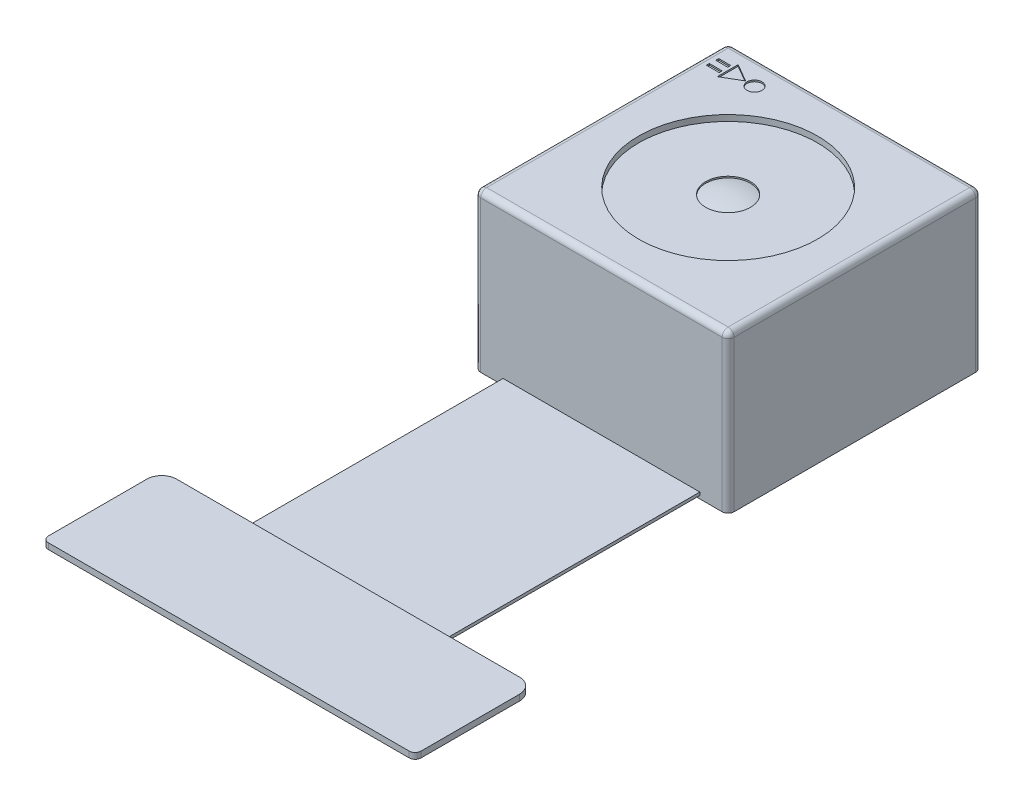
from build123d import *

# Parameters (mm, degrees)
SM_BASE_FLANGE_1_DEPTH = 0.1
SKETCH_6_W             = 12.5
SKETCH_6_H             = 4
EXTRUDE_1_DEPTH        = 0.1
SKETCH_7_W             = 8.5
SKETCH_7_H             = 8.5
EXTRUDE_2_DEPTH        = 0.1
SKETCH_8_W             = 8.5
SKETCH_8_H             = 8.5
EXTRUDE_3_DEPTH        = 5.07
SKETCH_9_R             = 3
CUT_EXTRUDE_1_DEPTH    = 0.2
FILLET_2_R             = 0.5
FILLET_3_R             = 0.2
SKETCH_11_R            = 0.25
SKETCH_11_W            = 0.4
SKETCH_11_H            = 0.1
SKETCH_11_W_2          = 0.428641975
CUT_EXTRUDE_2_DEPTH    = 0.05
FILLET_4_R             = 0.2
FILLET_5_R             = 0.2
SKETCH_13_R            = 0.75
CUT_EXTRUDE_3_DEPTH    = 0.05
DOME_1_FACE_RADIUS     = 0.75
DOME_1_HEIGHT          = 0.1
CUT_EXTRUDE_4_DEPTH    = 0.05


# Sheet-metal steps are written as plain solids
with BuildPart() as part:
    # Sketch 1 → Базовая кромка1 (new body)
    with BuildSketch(Plane(origin=(0, 0, 0), x_dir=(1, 0, 0), z_dir=(0, 1, 0))):
        Polygon((-6.25, 4), (-6.25, 0), (6.25, 0), (6.25, 4), (3.3, 4), (3.3, 12.5), (4.25, 12.5), (4.25, 21), (-4.25, 21), (-4.25, 12.5), (-3.3, 12.5), (-3.3, 4), align=None)
    extrude(amount=-SM_BASE_FLANGE_1_DEPTH)

    # Эскиз6 → Бобышка-Вытянуть1 (add)
    with BuildSketch(Plane(origin=(0, 0, 0), x_dir=(1, 0, 0), z_dir=(0, 1, 0))):
        with Locations((0, 2)):
            Rectangle(SKETCH_6_W, SKETCH_6_H)
    extrude(amount=EXTRUDE_1_DEPTH)

    # Эскиз7 → Бобышка-Вытянуть2 (add)
    with BuildSketch(Plane.XZ.offset(0.1)):
        with Locations((0, -16.75)):
            Rectangle(SKETCH_7_W, SKETCH_7_H)
    extrude(amount=EXTRUDE_2_DEPTH)

    # Эскиз8 → Бобышка-Вытянуть3 (add)
    with BuildSketch(Plane(origin=(0, 0, 0), x_dir=(1, 0, 0), z_dir=(0, 1, 0))):
        with Locations((0, 16.75)):
            Rectangle(SKETCH_8_W, SKETCH_8_H)
    extrude(amount=EXTRUDE_3_DEPTH)

    # Эскиз9 → Вырез-Вытянуть1 (cut)
    with BuildSketch(Plane(origin=(0, 5.07, 0), x_dir=(1, 0, 0), z_dir=(0, 1, 0))):
        with Locations(Location((0, 16.75, 0), (0, 0, 270))):
            Circle(SKETCH_9_R)
    extrude(amount=-CUT_EXTRUDE_1_DEPTH, mode=Mode.SUBTRACT)

    # Скругление2
    fillet_2_edges = [part.edges().sort_by_distance(p)[0] for p in [
        (6.25, 0, -4),
        (-6.25, 0, -4),
    ]]
    fillet(fillet_2_edges, radius=FILLET_2_R)

    # Скругление3
    fillet_3_edges = [part.edges().sort_by_distance(p)[0] for p in [
        (6.25, 0, 0),
        (-6.25, 0, 0),
    ]]
    fillet(fillet_3_edges, radius=FILLET_3_R)

    # Эскиз11 → Вырез-Вытянуть2 (cut)
    with BuildSketch(Plane(origin=(0, 5.07, 0), x_dir=(1, 0, 0), z_dir=(0, 1, 0))):
        with Locations(Location((-2.504881476, 20.140788589, 0), (0, 0, 270))):
            Circle(SKETCH_11_R)
        Polygon((-3.404881476, 20.490788589), (-3.404881476, 19.790788589), (-2.804881476, 20.140788589), align=None)
        with Locations((-3.704881476, 20.290788589)):
            Rectangle(SKETCH_11_W, SKETCH_11_H)
        with Locations((-3.704881477, 19.990788589)):
            Rectangle(SKETCH_11_W_2, SKETCH_11_H)
    extrude(amount=-CUT_EXTRUDE_2_DEPTH, mode=Mode.SUBTRACT)

    # Скругление4
    fillet_4_edges = [part.edges().sort_by_distance(p)[0] for p in [
        (-4.25, 2.435, -12.5),
        (-4.25, 2.435, -21),
        (4.25, 2.435, -21),
        (4.25, 2.435, -12.5),
    ]]
    fillet(fillet_4_edges, radius=FILLET_4_R)

    # Скругление5
    fillet_5_edges = [part.edges().sort_by_distance(p)[0] for p in [
        (0, 5.07, -21),
        (-4.25, 5.07, -16.75),
        (0, 5.07, -12.5),
        (4.25, 5.07, -16.75),
        (4.191421356, 5.07, -12.558578644),
        (-4.191421356, 5.07, -12.558578644),
        (4.191421356, 5.07, -20.941421356),
        (-4.191421356, 5.07, -20.941421356),
    ]]
    fillet(fillet_5_edges, radius=FILLET_5_R)

    # Эскиз13 → Вырез-Вытянуть3 (cut)
    with BuildSketch(Plane(origin=(0, 4.87, 0), x_dir=(1, 0, 0), z_dir=(0, 1, 0))):
        with Locations(Location((0, 16.75, 0), (0, 0, 270))):
            Circle(SKETCH_13_R)
    extrude(amount=-CUT_EXTRUDE_3_DEPTH, mode=Mode.SUBTRACT)

    # Купол1: a dome of height H over a round flat face of radius A is a cap of a sphere of radius (A * A + H * H) / (2 * H)
    dome_1_r = (DOME_1_FACE_RADIUS * DOME_1_FACE_RADIUS + DOME_1_HEIGHT * DOME_1_HEIGHT) / (2 * DOME_1_HEIGHT)
    dome_1_base = Plane((0, 4.82, -16.75), z_dir=(0, 1, 0))
    with Locations(dome_1_base.offset(DOME_1_HEIGHT - dome_1_r)):
        dome_1_ball = Sphere(dome_1_r, mode=Mode.PRIVATE)
    add(split(dome_1_ball, bisect_by=dome_1_base, keep=Keep.TOP, mode=Mode.PRIVATE))

    # Эскиз14 → Вырез-Вытянуть4 (cut)
    with BuildSketch(Plane.XZ.offset(0.1)):
        with BuildLine():
            add(Edge.make_bspline(
                [(-6.003383397, -0.314306436), (-6.003208457, -0.309686598), (-6.002887878, -0.301220725), (-6.001492735, -0.289495252), (-5.998110788, -0.280222293), (-5.994627409, -0.272683421), (-5.990132541, -0.267041234), (-5.984854454, -0.263323548), (-5.979244173, -0.261024904), (-5.975355275, -0.260713676), (-5.973471862, -0.260562946)],
                knots=[0, 0, 0, 0, 1.628349121, 2.98395659, 4.129704748, 5.086564407, 5.897483759, 6.63370628, 7.338296972, 8, 8, 8, 8], degree=3))
            Line((-5.973471862, -0.260562946), (-5.410745912, -0.260562946))
            add(Edge.make_bspline(
                [(-5.410745912, -0.260562946), (-5.40885651, -0.260694679), (-5.405106012, -0.26095617), (-5.399775012, -0.263392441), (-5.394773829, -0.267176005), (-5.390117693, -0.272704247), (-5.385920232, -0.280035282), (-5.383175234, -0.289598664), (-5.381181748, -0.301173725), (-5.380956895, -0.309674519), (-5.380834377, -0.314306436)],
                knots=[0, 0, 0, 0, 0.664614152, 1.319270975, 2.035609743, 2.868536476, 3.856564754, 4.99840066, 6.364487051, 8, 8, 8, 8], degree=3))
            add(Edge.make_bspline(
                [(-5.380834377, -0.314306436), (-5.380864917, -0.318693721), (-5.380922402, -0.326951838), (-5.382944792, -0.338274401), (-5.385655893, -0.347798587), (-5.388864391, -0.35564771), (-5.393178768, -0.361704746), (-5.397996026, -0.366346051), (-5.403899926, -0.368834535), (-5.407971139, -0.369283488), (-5.410016362, -0.369509025)],
                knots=[0, 0, 0, 0, 1.527993431, 2.876117242, 3.994749226, 4.982414938, 5.814060196, 6.574910721, 7.284088933, 8, 8, 8, 8], degree=3))
            Line((-5.410016362, -0.369509025), (-5.629853985, -0.369509025))
            Line((-5.629853985, -0.369509025), (-5.629853985, -1.163259025))
            Line((-5.629853985, -1.163259025), (-5.429714202, -1.038749221))
            add(Edge.make_bspline(
                [(-5.429714202, -1.038749221), (-5.425149481, -1.036424176), (-5.417333568, -1.032443135), (-5.40641212, -1.02878606), (-5.397209622, -1.028178755), (-5.389825008, -1.032459821), (-5.384765717, -1.040366747), (-5.38236471, -1.05167421), (-5.38104661, -1.066189675), (-5.380910144, -1.077004214), (-5.380834377, -1.083008565)],
                knots=[0, 0, 0, 0, 1.300400407, 2.226601497, 2.927610547, 3.564433773, 4.290758113, 5.250986372, 6.473717283, 8, 8, 8, 8], degree=3))
            add(Edge.make_bspline(
                [(-5.380834377, -1.083008565), (-5.380843974, -1.08746989), (-5.380861627, -1.095675966), (-5.381887136, -1.106960532), (-5.38325169, -1.116425903), (-5.385371952, -1.124314191), (-5.388422962, -1.13096114), (-5.392349709, -1.136754986), (-5.397873467, -1.141735037), (-5.401965467, -1.144813428), (-5.404179965, -1.146479383)],
                knots=[0, 0, 0, 0, 1.503218099, 2.764990822, 3.816270798, 4.724653119, 5.507171343, 6.272807373, 7.065282303, 8, 8, 8, 8], degree=3))
            Line((-5.404179965, -1.146479383), (-5.642985878, -1.308682585))
            add(Edge.make_bspline(
                [(-5.642985878, -1.308682585), (-5.644337471, -1.309545988), (-5.647229049, -1.311393143), (-5.652486271, -1.313205889), (-5.658748264, -1.314930023), (-5.666283445, -1.316627774), (-5.675194902, -1.318142504), (-5.685696762, -1.318759354), (-5.698186972, -1.318943259), (-5.707267063, -1.318913018), (-5.712293093, -1.318896279)],
                knots=[0, 0, 0, 0, 0.541215428, 1.157868723, 1.870271028, 2.742350482, 3.770919716, 4.926365934, 6.298675888, 8, 8, 8, 8], degree=3))
            add(Edge.make_bspline(
                [(-5.712293093, -1.318896279), (-5.719020011, -1.318761234), (-5.731266064, -1.318515389), (-5.747870516, -1.317817694), (-5.761037615, -1.315832622), (-5.771126699, -1.313415241), (-5.77827598, -1.310034132), (-5.783062441, -1.30596597), (-5.784970741, -1.30095795), (-5.785318853, -1.297666831), (-5.78549124, -1.296037058)],
                knots=[0, 0, 0, 0, 1.938222078, 3.528446385, 4.779762996, 5.770770152, 6.501593536, 7.046594974, 7.527870594, 8, 8, 8, 8], degree=3))
            Line((-5.78549124, -1.296037058), (-5.78549124, -0.369509025))
            Line((-5.78549124, -0.369509025), (-5.974444595, -0.369509025))
            add(Edge.make_bspline(
                [(-5.974444595, -0.369509025), (-5.976483759, -0.369264404), (-5.980691588, -0.368759627), (-5.986880194, -0.366432009), (-5.991996556, -0.361778766), (-5.996351899, -0.35568764), (-5.99925034, -0.347770297), (-6.001822213, -0.338280185), (-6.003127762, -0.326904664), (-6.003294537, -0.318685637), (-6.003383397, -0.314306436)],
                knots=[0, 0, 0, 0, 0.711765533, 1.468732524, 2.24630102, 3.073130576, 4.044150543, 5.148818068, 6.480854525, 8, 8, 8, 8], degree=3))
        make_face()
    extrude(amount=-CUT_EXTRUDE_4_DEPTH, mode=Mode.SUBTRACT)


solid = part.part
